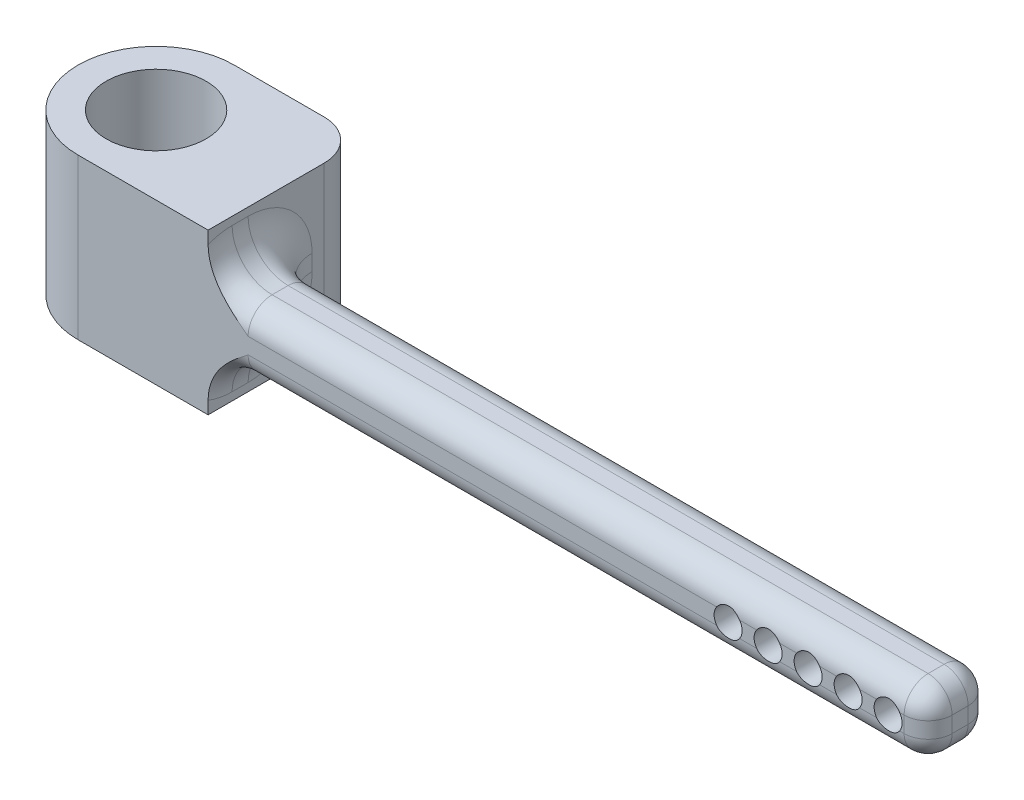
from build123d import *

# Parameters (mm, degrees)
SKETCH1_R           = 6.25
BOSS_EXTRUDE1_DEPTH = 20
BOSS_EXTRUDE2_DEPTH = 90
SKETCH3_R           = 1.75
CUT_EXTRUDE1_DEPTH  = 109.72585939
FILLET1_R           = 3
FILLET2_R           = 5


with BuildPart() as part:
    # Sketch1 → Boss-Extrude1 (new body)
    with BuildSketch(Plane(origin=(0, 0, 0), x_dir=(1, 0, 0), z_dir=(0, 1, 0))):
        with BuildLine():
            Line((0, 9.75), (11.25, 9.75))
            ThreePointArc((11.25, 9.75), (14.785533906, 8.285533906), (16.25, 4.75))
            Line((16.25, 4.75), (16.25, -9.75))
            Line((16.25, -9.75), (0, -9.75))
            ThreePointArc((0, -9.75), (-9.75, 0), (0, 9.75))
        make_face()
        with Locations(Location((0, 0, 0), (0, 0, 270))):
            Circle(SKETCH1_R, mode=Mode.SUBTRACT)
    extrude(amount=BOSS_EXTRUDE1_DEPTH)

    # Sketch2 → Boss-Extrude2 (add)
    with BuildSketch(Plane(origin=(16.25, 0, 0), x_dir=(0, 0, -1), z_dir=(1, 0, 0))):
        with BuildLine():
            Line((-6.75, 6), (-4.75, 6))
            ThreePointArc((-4.75, 6), (-2.628679656, 6.878679656), (-1.75, 9))
            Line((-1.75, 9), (-1.75, 11))
            ThreePointArc((-1.75, 11), (-2.628679656, 13.121320344), (-4.75, 14))
            Line((-4.75, 14), (-6.75, 14))
            ThreePointArc((-6.75, 14), (-8.871320344, 13.121320344), (-9.75, 11))
            Line((-9.75, 11), (-9.75, 9))
            ThreePointArc((-9.75, 9), (-8.871320344, 6.878679656), (-6.75, 6))
        make_face()
    extrude(amount=BOSS_EXTRUDE2_DEPTH)

    # Sketch3 → Cut-Extrude1 (cut, through all)
    with BuildSketch(Plane(origin=(0, 0, 1.75), x_dir=(-1, 0, 0), z_dir=(0, 0, -1))):
        with Locations(Location((-101.25, 10, 0), (0, 0, 34.849904579))):
            Circle(SKETCH3_R)
        with Locations(Location((-96.25, 10, 0), (0, 0, 34.849904579))):
            Circle(SKETCH3_R)
        with Locations(Location((-91.25, 10, 0), (0, 0, 34.849904579))):
            Circle(SKETCH3_R)
        with Locations(Location((-86.25, 10, 0), (0, 0, 34.849904579))):
            Circle(SKETCH3_R)
        with Locations(Location((-81.25, 10, 0), (0, 0, 34.849904579))):
            Circle(SKETCH3_R)
    extrude(amount=-CUT_EXTRUDE1_DEPTH, mode=Mode.SUBTRACT)

    # Fillet1
    fillet1_edges = [part.edges().sort_by_distance(p)[0] for p in [
        (106.25, 6.878679656, 8.871320344),
        (106.25, 6, 5.75),
        (106.25, 6.878679656, 2.628679656),
        (106.25, 10, 1.75),
        (106.25, 13.121320344, 2.628679656),
        (106.25, 14, 5.75),
        (106.25, 13.121320344, 8.871320344),
        (106.25, 10, 9.75),
    ]]
    fillet(fillet1_edges, radius=FILLET1_R)

    # Fillet2
    # the kernel refuses this fillet: 5 mm, written as the material it adds along each edge
    with BuildSketch(Plane(origin=(16.25, 9, 6.75), x_dir=(1.1842378929335002e-15, -0.8556201630305047, -0.5176042277799251), z_dir=(0, -0.5176042277799251, 0.8556201630305047))) as fillet2_piece_1_section:
        with BuildLine():
            CenterArc((-3 - FILLET2_R, FILLET2_R), FILLET2_R, 270, 90)
            Line((-3, FILLET2_R), (-3, 0))
            Line((-3, 0), (-3 - FILLET2_R, 0))
        make_face()
    fillet2_piece_1 = revolve(axis=Axis((16.25, 9, 6.75), (1, 0, 0)), revolution_arc=328.828315396, mode=Mode.PRIVATE)
    fillet2_piece_1 = split(fillet2_piece_1, bisect_by=Plane(origin=(16.92449451, 12.664519723, 9.75), z_dir=(0, 0, -1)), keep=Keep.TOP, mode=Mode.PRIVATE)
    add(fillet2_piece_1)
    with BuildSketch(Plane(origin=(16.25, 6, 6.75), x_dir=(0, -1, 0), z_dir=(0, 0, -1)), Plane(origin=(16.25, 9, 1.75), x_dir=(0, 0, -1), z_dir=(0, 1, 0))) as fillet2_piece_2:
        with BuildLine():
            CenterArc((FILLET2_R, -FILLET2_R), FILLET2_R, 90, 90)
            Line((0, -FILLET2_R), (0, 0))
            Line((0, 0), (FILLET2_R, 0))
        make_face()
    extrude(amount=2)
    with BuildSketch(Plane(origin=(16.25, 9, 4.75), x_dir=(0, -1, 0), z_dir=(0, 0, 1))) as fillet2_piece_3:
        with BuildLine():
            CenterArc((3 + FILLET2_R, FILLET2_R), FILLET2_R, 180, 90)
            Line((3, FILLET2_R), (3, 0))
            Line((3, 0), (3 + FILLET2_R, 0))
        make_face()
    revolve(axis=Axis((16.25, 9, 4.75), (1, 0, 0)), revolution_arc=90)
    with BuildSketch(Plane(origin=(16.25, 11, 4.75), x_dir=(0, 0, -1), z_dir=(0, -1, 0))) as fillet2_piece_4:
        with BuildLine():
            CenterArc((3 + FILLET2_R, FILLET2_R), FILLET2_R, 180, 90)
            Line((3, FILLET2_R), (3, 0))
            Line((3, 0), (3 + FILLET2_R, 0))
        make_face()
    revolve(axis=Axis((16.25, 11, 4.75), (1, 0, 0)), revolution_arc=90)
    with BuildSketch(Plane(origin=(16.25, 14, 4.75), x_dir=(1, 0, 0), z_dir=(0, 0, 1))) as fillet2_piece_5:
        with BuildLine():
            CenterArc((FILLET2_R, FILLET2_R), FILLET2_R, 180, 90)
            Line((0, FILLET2_R), (0, 0))
            Line((0, 0), (FILLET2_R, 0))
        make_face()
    extrude(amount=2)
    with BuildSketch(Plane(origin=(16.25, 11, 6.75), x_dir=(0, 1, 0), z_dir=(0, 0, -1))) as fillet2_piece_6_section:
        with BuildLine():
            CenterArc((3 + FILLET2_R, FILLET2_R), FILLET2_R, 180, 90)
            Line((3 + FILLET2_R, 0), (3, 0))
            Line((3, 0), (3, FILLET2_R))
        make_face()
    fillet2_piece_6 = revolve(axis=Axis((16.25, 11, 6.75), (1, 0, 0)), revolution_arc=328.828315396, mode=Mode.PRIVATE)
    fillet2_piece_6 = split(fillet2_piece_6, bisect_by=Plane(origin=(17.971658099, 13.274254424, 9.75), z_dir=(0, 0, -1)), keep=Keep.TOP, mode=Mode.PRIVATE)
    add(fillet2_piece_6)


solid = part.part
